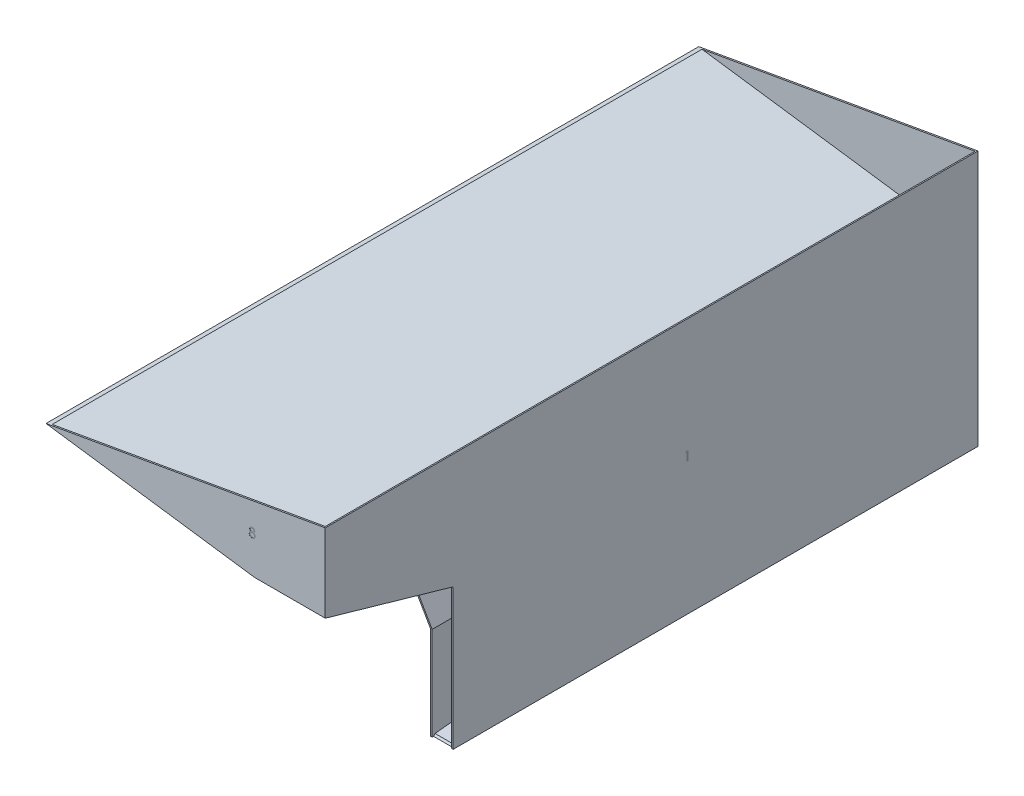
from build123d import *

# Parameters (mm, degrees)
BOSS_EXTRUDE1_DEPTH = 701.675
SHELL1_T            = -3.175
SKETCH3_W           = 42
SKETCH3_H           = 290
CUT_EXTRUDE1_DEPTH  = 20
SKETCH7_W           = 275
SKETCH7_H           = 302.7
CUT_EXTRUDE5_DEPTH  = 100
CUT_EXTRUDE7_DEPTH  = 988.549739455
BOSS_EXTRUDE3_DEPTH = 6.35
BOSS_EXTRUDE4_DEPTH = 42
CHAMFER1_SIZE       = 7.134884114
CHAMFER1_SIZE_2     = 6.35
CUT_EXTRUDE8_DEPTH  = 0.1
CUT_EXTRUDE9_DEPTH  = 0.1
CUT_EXTRUDE10_DEPTH = 0.1
CUT_EXTRUDE11_DEPTH = 0.1
CUT_EXTRUDE12_DEPTH = 0.1
CUT_EXTRUDE13_DEPTH = 0.1
CUT_EXTRUDE14_DEPTH = 0.1
CUT_EXTRUDE15_DEPTH = 0.1


with BuildPart() as part:
    # Sketch2 → Boss-Extrude1 (new, symmetric)
    with BuildSketch(Plane.XY):
        Polygon((0, 0), (-105, 181.865334795), (-551.988806236, 244.144070894), (48.35, 350), (48.35, -200), (0, -200), align=None)
    extrude(amount=BOSS_EXTRUDE1_DEPTH, both=True)

    # Shell1
    shell1_openings = [part.faces().sort_by_distance(p)[0] for p in [
        (-251.819403118, 297.072035447, 0),
    ]]
    offset(amount=SHELL1_T, openings=shell1_openings, kind=Kind.INTERSECTION)

    # Sketch3 → Cut-Extrude1 (cut)
    with BuildSketch(Plane.XY.offset(701.675)):
        with Locations((24.175, -42.3)):
            Rectangle(SKETCH3_W, SKETCH3_H)
    extrude(amount=-CUT_EXTRUDE1_DEPTH, mode=Mode.SUBTRACT)

    # Sketch7 → Cut-Extrude5 (cut, symmetric)
    with BuildSketch(Plane.ZY):
        with Locations((564.175, -48.65)):
            Rectangle(SKETCH7_W, SKETCH7_H)
    extrude(amount=CUT_EXTRUDE5_DEPTH, both=True, mode=Mode.SUBTRACT)

    # Sketch9 → Cut-Extrude7 (cut, through all)
    with BuildSketch(Plane(origin=(48.35, 0, 0), x_dir=(0, 0, -1), z_dir=(1, 0, 0))):
        Polygon((-701.675, 102.7), (-426.675, 102.7), (-701.675, 181.7), align=None)
    extrude(amount=-CUT_EXTRUDE7_DEPTH, mode=Mode.SUBTRACT)

    # Sketch11 → Boss-Extrude3 (add)
    with BuildSketch(Plane(origin=(0, -18.35715529, 5.273510065), x_dir=(1, 0, 0), z_dir=(0, -0.9611272890955623, 0.27610565759472516))):
        Polygon((48.35, 724.567388561), (48.35, 438.44503711), (-59.293872646, 438.44503711), (-104.904543912, 724.567388561), align=None)
    extrude(amount=-BOSS_EXTRUDE3_DEPTH)

    # Sketch12 → Boss-Extrude4 (add)
    with BuildSketch(Plane(origin=(3.175, 0, 0), x_dir=(0, 0, -1), z_dir=(1, 0, 0))):
        Polygon((688.975, -79.565459926), (-396.466892858, -193.65), (-396.466892858, -196.825), (688.975, -82.740459926), align=None)
        Polygon((-396.466892858, -193.65), (-426.675, -196.825), (-396.466892858, -196.825), align=None)
    extrude(amount=BOSS_EXTRUDE4_DEPTH)

    # Chamfer1
    # the kernel refuses this chamfer: 7.134884114, 6.35 mm, written as the material it takes off along each edge
    with BuildSketch(Plane(origin=(3.175, -196.825, 426.675), x_dir=(0, -0.9997021141585574, 0.02440661686737172), z_dir=(1, 0, 0))) as chamfer1_piece_1:
        Polygon((CHAMFER1_SIZE * 0.999702114118, CHAMFER1_SIZE * 0.0244066168664), (-CHAMFER1_SIZE_2 * 0.128770240585, CHAMFER1_SIZE_2 * 0.991674455222), (0, 0), align=None)
    extrude(amount=42, mode=Mode.SUBTRACT)

    # Sketch14 → Cut-Extrude8 (cut)
    with BuildSketch(Plane(origin=(48.35, 0, 0), x_dir=(0, 0, -1), z_dir=(1, 0, 0))):
        Polygon((74.636196394, 103.982801656), (78.158462019, 103.982801656), (78.158462019, 84.932801656), (76.448846634, 84.932801656), (76.448846634, 102.028955502), (73.518077403, 102.028955502), align=None)
    extrude(amount=-CUT_EXTRUDE8_DEPTH, mode=Mode.SUBTRACT)

    # Sketch15 → Cut-Extrude9 (cut)
    with BuildSketch(Plane(origin=(0, 0, -701.675), x_dir=(-1, 0, 0), z_dir=(0, 0, -1))):
        with BuildLine():
            Line((32.117058619, 218.448304315), (30.407443235, 218.448304315))
            add(Edge.make_bspline(
                [(30.407443235, 218.448304315), (30.418585596, 218.675113004), (30.440468897, 219.120559233), (30.542948586, 219.77002221), (30.689583932, 220.390806185), (30.896910275, 220.977926717), (31.154391586, 221.536575082), (31.463165021, 222.064532311), (31.82889155, 222.559784352), (32.243673917, 223.017740056), (32.694171795, 223.437860977), (33.180251266, 223.800655942), (33.691036343, 224.107184982), (34.224977357, 224.363441455), (34.788098425, 224.555791188), (35.375289408, 224.698511826), (35.989130136, 224.784380222), (36.407359399, 224.793610141), (36.620063427, 224.798304315)],
                knots=[0, 0, 0, 0, 1.10065271, 2.161652631, 3.183658789, 4.190468796, 5.17591951, 6.163126047, 7.15150782, 8.156236427, 9.156009102, 10.134482811, 11.092018607, 12.041330605, 13.001268258, 13.972401359, 14.968799086, 16, 16, 16, 16], degree=3))
            add(Edge.make_bspline(
                [(36.620063427, 224.798304315), (36.828949802, 224.793414145), (37.239404066, 224.783805135), (37.838455888, 224.701285819), (38.408743733, 224.572041956), (38.949152863, 224.390710904), (39.455371585, 224.146955664), (39.931202728, 223.854143346), (40.382311141, 223.515489692), (40.788385206, 223.116779651), (41.161264894, 222.691135244), (41.482950026, 222.236722511), (41.758430244, 221.767388828), (41.988051759, 221.27955533), (42.157085887, 220.768628733), (42.285418705, 220.242047529), (42.357957914, 219.694361058), (42.369090861, 219.323666805), (42.374750927, 219.135203353)],
                knots=[0, 0, 0, 0, 1.111607364, 2.184268762, 3.212621178, 4.221274766, 5.211760367, 6.196651075, 7.1921475, 8.207485113, 9.220403448, 10.201281604, 11.166441695, 12.114753415, 13.065576456, 14.026450734, 14.996634279, 16, 16, 16, 16], degree=3))
            add(Edge.make_bspline(
                [(42.374750927, 219.135203353), (42.365534739, 218.869875854), (42.347264095, 218.343876976), (42.190975845, 217.570910366), (41.946882692, 216.822009042), (41.652982792, 216.219281727), (41.356497061, 215.733596568), (41.08932077, 215.333716903), (40.776548013, 214.903157139), (40.413626474, 214.44335906), (40.008063555, 213.950721133), (39.55618578, 213.425540961), (39.054770828, 212.873244614), (38.702843846, 212.496024127), (38.5204841, 212.300557921)],
                knots=[0, 0, 0, 0, 1.184426356, 2.348067706, 3.509069118, 4.696110526, 5.333549288, 6.050745305, 6.844228056, 7.710549037, 8.667450064, 9.695053472, 10.805634456, 12, 12, 12, 12], degree=3))
            Line((38.5204841, 212.300557921), (33.754167994, 207.21368893))
            Line((33.754167994, 207.21368893), (42.618981696, 207.21368893))
            Line((42.618981696, 207.21368893), (42.618981696, 205.259842776))
            Line((42.618981696, 205.259842776), (29.674750927, 205.259842776))
            Line((29.674750927, 205.259842776), (37.062731696, 213.143917296))
            add(Edge.make_bspline(
                [(37.062731696, 213.143917296), (37.242606623, 213.33168665), (37.588109545, 213.692353151), (38.076783284, 214.218911263), (38.515689778, 214.707405192), (38.907670159, 215.156911977), (39.244221095, 215.574006653), (39.542882815, 215.945180683), (39.782181246, 216.286744191), (40.041889328, 216.682660961), (40.293425427, 217.166053716), (40.509574107, 217.756787081), (40.641372068, 218.364902557), (40.657182673, 218.775849358), (40.665135542, 218.982559123)],
                knots=[0, 0, 0, 0, 1.329631726, 2.553950428, 3.673215718, 4.687767853, 5.603093632, 6.413772471, 7.123043292, 7.734684054, 8.834405432, 9.900288307, 10.943827018, 12, 12, 12, 12], degree=3))
            add(Edge.make_bspline(
                [(40.665135542, 218.982559123), (40.661675288, 219.112542162), (40.654855791, 219.368713774), (40.594670323, 219.744302262), (40.503717426, 220.106605034), (40.373386807, 220.456736518), (40.201355836, 220.791176425), (39.991950725, 221.110331853), (39.750341951, 221.418881792), (39.470844328, 221.7081876), (39.163804485, 221.973152447), (38.839441498, 222.207870683), (38.496268787, 222.404026415), (38.135733265, 222.564827449), (37.758840067, 222.690967739), (37.36486024, 222.778372292), (36.95488238, 222.833249812), (36.674937211, 222.840674805), (36.532292994, 222.844458161)],
                knots=[0, 0, 0, 0, 0.991446411, 1.95395049, 2.89581595, 3.838931463, 4.798493298, 5.75982156, 6.748411868, 7.785213223, 8.824556874, 9.840280684, 10.836137867, 11.835679398, 12.848801643, 13.863922112, 14.911575587, 16, 16, 16, 16], degree=3))
            add(Edge.make_bspline(
                [(36.532292994, 222.844458161), (36.383317462, 222.840566343), (36.090754114, 222.832923454), (35.661209092, 222.779460097), (35.25143936, 222.687226308), (34.860414145, 222.561078981), (34.487471828, 222.400740308), (34.134426103, 222.201032383), (33.80206952, 221.962725085), (33.4897773, 221.692538628), (33.202046214, 221.39172497), (32.949242504, 221.056390743), (32.728349512, 220.692658667), (32.535622113, 220.301510185), (32.379109, 219.87939604), (32.259512281, 219.427814675), (32.164878158, 218.94872687), (32.13326321, 218.617882337), (32.117058619, 218.448304315)],
                knots=[0, 0, 0, 0, 1.031018746, 2.02475058, 2.990194455, 3.934040569, 4.864654155, 5.795059489, 6.735614925, 7.690564532, 8.649604399, 9.611025574, 10.590972636, 11.591080095, 12.624614302, 13.701020113, 14.821632451, 16, 16, 16, 16], degree=3))
        make_face()
    extrude(amount=-CUT_EXTRUDE9_DEPTH, mode=Mode.SUBTRACT)

    # Sketch16 → Cut-Extrude10 (cut)
    with BuildSketch(Plane(origin=(22.857155358, 164.05105863, 0), x_dir=(0.9904327144038478, -0.13799651531334484, 0), z_dir=(-0.13799651531334484, -0.9904327144038478, 0))):
        with BuildLine():
            Line((-366.527847763, -7.379708611), (-368.237463148, -7.379708611))
            add(Edge.make_bspline(
                [(-368.237463148, -7.379708611), (-368.191146879, -7.187943234), (-368.100602362, -6.813057607), (-367.911748427, -6.277440944), (-367.70601248, -5.77058292), (-367.458966068, -5.301974291), (-367.189496992, -4.862197406), (-366.880763322, -4.461226885), (-366.547008832, -4.088864888), (-366.177847322, -3.758411409), (-365.790704178, -3.459175483), (-365.380124319, -3.204041242), (-364.954368284, -2.984562639), (-364.510486231, -2.803749662), (-364.04715664, -2.667539312), (-363.568568261, -2.568714413), (-363.073466925, -2.504537063), (-362.73738361, -2.498273624), (-362.566729975, -2.495093226)],
                knots=[0, 0, 0, 0, 1.162005537, 2.271625781, 3.343758855, 4.383309926, 5.390229558, 6.379919256, 7.361854164, 8.333198761, 9.295911338, 10.242430842, 11.177959212, 12.116337295, 13.062827104, 14.020064771, 14.994644689, 16, 16, 16, 16], degree=3))
            add(Edge.make_bspline(
                [(-362.566729975, -2.495093226), (-362.318085336, -2.502600179), (-361.826219719, -2.517450337), (-361.103609421, -2.653056056), (-360.406777734, -2.867641419), (-359.743351971, -3.164134134), (-359.127120216, -3.529825081), (-358.578827543, -3.965061721), (-358.105905791, -4.46144649), (-357.709152107, -5.009719447), (-357.39850104, -5.595673006), (-357.169430922, -6.198742432), (-357.029975773, -6.817497162), (-357.011902456, -7.235276068), (-357.002847763, -7.444582409)],
                knots=[0, 0, 0, 0, 1.083050992, 2.142477498, 3.193116406, 4.255571735, 5.30263384, 6.308962982, 7.297363603, 8.282367274, 9.249857812, 10.179914175, 11.08814088, 12, 12, 12, 12], degree=3))
            add(Edge.make_bspline(
                [(-357.002847763, -7.444582409), (-357.009181023, -7.646005106), (-357.02157423, -8.040158066), (-357.126804827, -8.615585072), (-357.303895058, -9.157920068), (-357.549203337, -9.669446108), (-357.866748061, -10.146919879), (-358.251409454, -10.591415656), (-358.705902513, -11.004904931), (-359.050320733, -11.241775205), (-359.227637427, -11.363723034)],
                knots=[0, 0, 0, 0, 1.024540389, 2.004866551, 2.965041327, 3.920577974, 4.882998113, 5.874504559, 6.905732034, 8, 8, 8, 8], degree=3))
            add(Edge.make_bspline(
                [(-359.227637427, -11.363723034), (-359.024990305, -11.461575653), (-358.623487747, -11.655449994), (-358.076205579, -12.035664903), (-357.579393143, -12.474665879), (-357.302331473, -12.817253747), (-357.163124206, -12.989384091)],
                knots=[0, 0, 0, 0, 1.015518401, 2.012035669, 3.001164323, 4, 4, 4, 4], degree=3))
            add(Edge.make_bspline(
                [(-357.163124206, -12.989384091), (-357.071459185, -13.114884139), (-356.889630222, -13.363829085), (-356.665191103, -13.764077346), (-356.461578638, -14.168761881), (-356.302918158, -14.588729505), (-356.180051826, -15.019112622), (-356.092225708, -15.460650235), (-356.037665741, -15.9137029), (-356.029852236, -16.220203685), (-356.025924686, -16.374269909)],
                knots=[0, 0, 0, 0, 1.025084078, 2.033381695, 3.024893161, 4.013698104, 4.991890475, 5.976764909, 6.982997093, 8, 8, 8, 8], degree=3))
            add(Edge.make_bspline(
                [(-356.025924686, -16.374269909), (-356.035691967, -16.64102282), (-356.055180563, -17.173273298), (-356.229374168, -17.959628569), (-356.499411949, -18.728298803), (-356.882898987, -19.463491856), (-357.35026357, -20.151362216), (-357.906291292, -20.766820412), (-358.544664458, -21.29585853), (-359.256620918, -21.7378742), (-360.027967003, -22.091213176), (-360.852971297, -22.336454401), (-361.71974659, -22.496180485), (-362.31414631, -22.513308443), (-362.61633935, -22.522016303)],
                knots=[0, 0, 0, 0, 0.955779014, 1.907060117, 2.875433937, 3.871313158, 4.872415639, 5.851225146, 6.836215519, 7.83643374, 8.849228613, 9.86973379, 10.916971861, 12, 12, 12, 12], degree=3))
            add(Edge.make_bspline(
                [(-362.61633935, -22.522016303), (-362.820007256, -22.517290742), (-363.220757779, -22.507992415), (-363.809911677, -22.444427457), (-364.372276927, -22.328331285), (-364.908613881, -22.172103295), (-365.419399007, -21.974028241), (-365.903073637, -21.727365042), (-366.362613486, -21.437198152), (-366.793682063, -21.100102481), (-367.196227981, -20.723014047), (-367.559553523, -20.299238578), (-367.889716111, -19.836609851), (-368.17787533, -19.329754359), (-368.437156458, -18.785222316), (-368.650412807, -18.196041204), (-368.838112831, -17.56747817), (-368.925380686, -17.129449327), (-368.970155456, -16.904708611)],
                knots=[0, 0, 0, 0, 1.048658725, 2.063410685, 3.046034179, 4.001477787, 4.936774919, 5.862367409, 6.792675028, 7.730719943, 8.675894397, 9.627829632, 10.600096036, 11.597688215, 12.626045268, 13.701542398, 14.82072376, 16, 16, 16, 16], degree=3))
            Line((-368.970155456, -16.904708611), (-367.260540071, -16.904708611))
            add(Edge.make_bspline(
                [(-367.260540071, -16.904708611), (-367.215999585, -17.05138824), (-367.12936447, -17.33669286), (-366.981894076, -17.747303666), (-366.813882481, -18.12372107), (-366.633644669, -18.468706349), (-366.444350556, -18.785656996), (-366.232542178, -19.066192026), (-366.013907259, -19.322633341), (-365.849101064, -19.467111872), (-365.768442715, -19.537821591)],
                knots=[0, 0, 0, 0, 1.198163088, 2.33053128, 3.407730985, 4.417276592, 5.372219308, 6.28897303, 7.162600585, 8, 8, 8, 8], degree=3))
            add(Edge.make_bspline(
                [(-365.768442715, -19.537821591), (-365.661781349, -19.620054094), (-365.448787855, -19.784265267), (-365.101706483, -19.993824131), (-364.736681889, -20.175403426), (-364.345804876, -20.314107542), (-363.937510197, -20.431551667), (-363.505198395, -20.508407635), (-363.052683513, -20.561138968), (-362.743704686, -20.565792238), (-362.585810504, -20.568170149)],
                knots=[0, 0, 0, 0, 0.946170439, 1.889420265, 2.845303464, 3.807233317, 4.801018734, 5.828864929, 6.890507805, 8, 8, 8, 8], degree=3))
            add(Edge.make_bspline(
                [(-362.585810504, -20.568170149), (-362.407537868, -20.564817865), (-362.058941118, -20.558262762), (-361.550279669, -20.497979272), (-361.066369133, -20.410183736), (-360.612582209, -20.27458593), (-360.182974733, -20.107050152), (-359.783568897, -19.896692403), (-359.409121519, -19.649887561), (-359.064428613, -19.369367283), (-358.75448235, -19.062273146), (-358.481580143, -18.74107343), (-358.249580199, -18.407122415), (-358.062435295, -18.058572071), (-357.914658729, -17.696865754), (-357.814057308, -17.320988411), (-357.744108347, -16.934016148), (-357.738411787, -16.670968474), (-357.735540071, -16.538362457)],
                knots=[0, 0, 0, 0, 1.217147791, 2.380027433, 3.494444702, 4.572153297, 5.609568379, 6.639424714, 7.649109417, 8.668170816, 9.669597737, 10.625200337, 11.543417969, 12.441394052, 13.322311151, 14.205496177, 15.095365482, 16, 16, 16, 16], degree=3))
            add(Edge.make_bspline(
                [(-357.735540071, -16.538362457), (-357.743869283, -16.360863598), (-357.760486264, -16.00674909), (-357.887351532, -15.485772007), (-358.096024493, -14.983813148), (-358.388156304, -14.509436634), (-358.743769342, -14.069784941), (-359.15941262, -13.677510158), (-359.638537692, -13.353822948), (-360.079517265, -13.130183261), (-360.47012476, -12.977581466), (-360.804399923, -12.875936303), (-361.178632293, -12.789864834), (-361.588296278, -12.709788042), (-362.036478642, -12.641636132), (-362.522691454, -12.584802821), (-363.047033242, -12.539327527), (-363.410023731, -12.519019708), (-363.597078532, -12.508554765)],
                knots=[0, 0, 0, 0, 1.07054697, 2.135767047, 3.216561865, 4.33974944, 5.486079747, 6.621378074, 7.775625952, 8.963672916, 9.598146892, 10.304877434, 11.070270905, 11.915000392, 12.823868403, 13.805723172, 14.86925407, 16, 16, 16, 16], degree=3))
            Line((-363.597078532, -12.508554765), (-363.597078532, -10.554708611))
            add(Edge.make_bspline(
                [(-363.597078532, -10.554708611), (-363.361396473, -10.550709179), (-362.899753216, -10.542875275), (-362.225414214, -10.448125961), (-361.580580901, -10.317058543), (-360.979543919, -10.11629771), (-360.431727351, -9.883124095), (-359.956459231, -9.61178564), (-359.560398044, -9.310171076), (-359.245468497, -8.973625017), (-359.008545124, -8.612681687), (-358.835316413, -8.236489593), (-358.732988923, -7.84175149), (-358.719329164, -7.572359083), (-358.712463148, -7.436950197)],
                knots=[0, 0, 0, 0, 1.321986639, 2.589447074, 3.816329219, 5.01088745, 6.139805852, 7.153945165, 8.075214402, 8.924034688, 9.728124013, 10.488707548, 11.240355623, 12, 12, 12, 12], degree=3))
            add(Edge.make_bspline(
                [(-358.712463148, -7.436950197), (-358.714718727, -7.337467041), (-358.719206096, -7.139550021), (-358.775796994, -6.850397862), (-358.860836417, -6.57008557), (-358.977747515, -6.299805203), (-359.134230739, -6.041431284), (-359.321497609, -5.792761026), (-359.544481126, -5.555214172), (-359.799998488, -5.333797004), (-360.074382741, -5.122781584), (-360.375099373, -4.94363736), (-360.693081291, -4.790447808), (-361.028680541, -4.664121804), (-361.382986213, -4.569093392), (-361.75433362, -4.500862598), (-362.143430869, -4.458203363), (-362.408888439, -4.452061557), (-362.54383334, -4.44893938)],
                knots=[0, 0, 0, 0, 0.884392785, 1.759457502, 2.611959086, 3.489218968, 4.37281399, 5.2945488, 6.255912374, 7.266815255, 8.301784654, 9.332968512, 10.37626691, 11.440494194, 12.520033166, 13.637162961, 14.798855837, 16, 16, 16, 16], degree=3))
            add(Edge.make_bspline(
                [(-362.54383334, -4.44893938), (-362.760740276, -4.456512365), (-363.18440997, -4.471304165), (-363.795179732, -4.600860567), (-364.362974965, -4.80756985), (-364.796981136, -5.054310998), (-365.117470575, -5.297881217), (-365.346489339, -5.510601063), (-365.571390974, -5.746999717), (-365.777379586, -6.021637445), (-365.985699374, -6.315915261), (-366.175353344, -6.644792727), (-366.359646812, -6.999690931), (-366.470694975, -7.250582884), (-366.527847763, -7.379708611)],
                knots=[0, 0, 0, 0, 1.472543308, 2.876219568, 4.221790263, 5.565193594, 6.249813518, 6.953379497, 7.687249741, 8.463570142, 9.283606569, 10.136032583, 11.040678096, 12, 12, 12, 12], degree=3))
        make_face()
    extrude(amount=-CUT_EXTRUDE10_DEPTH, mode=Mode.SUBTRACT)

    # Sketch17 → Cut-Extrude11 (cut)
    with BuildSketch(Plane(origin=(0, 0, 0), x_dir=(0, 0, 1), z_dir=(-0.8660254037844379, -0.5000000000000014, 0))):
        Polygon((-17.833703536, 134.05795176), (-17.486437911, 134.05795176), (-17.486437911, 120.869490222), (-15.288360988, 120.869490222), (-15.288360988, 118.915644068), (-17.486437911, 118.915644068), (-17.486437911, 114.519490222), (-19.196053296, 114.519490222), (-19.196053296, 118.915644068), (-28.232591757, 118.915644068), align=None)
        Polygon((-19.196053296, 120.869490222), (-19.196053296, 129.142807529), (-24.874418681, 120.869490222), align=None, mode=Mode.SUBTRACT)
    extrude(amount=-CUT_EXTRUDE11_DEPTH, mode=Mode.SUBTRACT)

    # Sketch18 → Cut-Extrude12 (cut)
    with BuildSketch(Plane.ZY):
        with BuildLine():
            Line((-168.934113703, -82.768057658), (-168.934113703, -84.721903812))
            Line((-168.934113703, -84.721903812), (-175.413861299, -84.721903812))
            Line((-175.413861299, -84.721903812), (-176.440393751, -89.732450687))
            add(Edge.make_bspline(
                [(-176.440393751, -89.732450687), (-176.238703921, -89.676768779), (-175.847961773, -89.568893889), (-175.271237387, -89.449119624), (-174.723728394, -89.376917707), (-174.368443878, -89.367059003), (-174.196523559, -89.362288427)],
                knots=[0, 0, 0, 0, 1.100273476, 2.13160584, 3.095893838, 4, 4, 4, 4], degree=3))
            add(Edge.make_bspline(
                [(-174.196523559, -89.362288427), (-173.983796347, -89.366892734), (-173.565521499, -89.375945953), (-172.953532373, -89.462878447), (-172.369334768, -89.599711411), (-171.814150439, -89.790867394), (-171.286952299, -90.035304656), (-170.792590858, -90.340648617), (-170.323645646, -90.697337177), (-169.888529527, -91.107429313), (-169.493790078, -91.558759827), (-169.146720906, -92.044033383), (-168.851921665, -92.558533944), (-168.614826699, -93.107177257), (-168.425500536, -93.683897792), (-168.299487536, -94.294763705), (-168.215576591, -94.934017044), (-168.206201889, -95.371103347), (-168.201421395, -95.593989148)],
                knots=[0, 0, 0, 0, 1.052922333, 2.070308379, 3.05430497, 4.020497103, 4.973039431, 5.925935799, 6.892292201, 7.88610001, 8.88166317, 9.857072816, 10.836096531, 11.812156883, 12.81219415, 13.836441305, 14.89672472, 16, 16, 16, 16], degree=3))
            add(Edge.make_bspline(
                [(-168.201421395, -95.593989148), (-168.205041305, -95.749231519), (-168.212232205, -96.057618294), (-168.248800517, -96.515603158), (-168.319207772, -96.963892292), (-168.413737813, -97.402545168), (-168.536432974, -97.830731322), (-168.684963396, -98.249676353), (-168.866733203, -98.656772712), (-169.066112545, -99.055872363), (-169.290611233, -99.437952809), (-169.539777108, -99.795270864), (-169.803023568, -100.133186739), (-170.086277394, -100.448076343), (-170.392171382, -100.737870483), (-170.717000916, -101.004288987), (-171.058174001, -101.25183737), (-171.420968963, -101.470467118), (-171.79730162, -101.671651208), (-172.19260663, -101.83669789), (-172.597885586, -101.984256622), (-173.018971552, -102.101874193), (-173.454910732, -102.194035669), (-173.906421724, -102.256631795), (-174.371136514, -102.302223547), (-174.686141939, -102.305077547), (-174.84526154, -102.306519196)],
                knots=[0, 0, 0, 0, 1.056347294, 2.098418968, 3.122841568, 4.141288669, 5.149314143, 6.15115421, 7.162517403, 8.180376062, 9.185164535, 10.17417709, 11.141909838, 12.097768115, 13.052685741, 14.0056014, 14.954263652, 15.917497458, 16.885230207, 17.854509472, 18.828990115, 19.81800267, 20.826176721, 21.857883937, 22.917946725, 24, 24, 24, 24], degree=3))
            add(Edge.make_bspline(
                [(-174.84526154, -102.306519196), (-175.035076723, -102.302759064), (-175.408515673, -102.295361448), (-175.95563476, -102.217972264), (-176.482038542, -102.107134376), (-176.983489521, -101.940385536), (-177.464481685, -101.731448975), (-177.918539621, -101.467382384), (-178.357265344, -101.168138976), (-178.762823716, -100.815004484), (-179.139230562, -100.429020557), (-179.476178846, -100.01015111), (-179.776263028, -99.565309433), (-180.034677622, -99.092335194), (-180.255102567, -98.59247119), (-180.428267003, -98.063844571), (-180.568030621, -97.509217407), (-180.627158667, -97.127381871), (-180.657190626, -96.933442273)],
                knots=[0, 0, 0, 0, 1.0467383, 2.05933395, 3.04377827, 4.011590433, 4.970194871, 5.932262533, 6.905835911, 7.896367577, 8.894135286, 9.877477877, 10.858688626, 11.851381753, 12.8477658, 13.868841284, 14.917554742, 16, 16, 16, 16], degree=3))
            Line((-180.657190626, -96.933442273), (-178.947575242, -96.933442273))
            add(Edge.make_bspline(
                [(-178.947575242, -96.933442273), (-178.905509808, -97.115105536), (-178.824657708, -97.464272414), (-178.647189276, -97.954844429), (-178.430205011, -98.392010489), (-178.172189914, -98.781553507), (-177.864396177, -99.121236763), (-177.513171714, -99.423952486), (-177.119393392, -99.697048547), (-176.681824528, -99.924683894), (-176.220199054, -100.118823823), (-175.737051811, -100.248100906), (-175.245538153, -100.33900148), (-174.91309731, -100.348100635), (-174.74604279, -100.352673043)],
                knots=[0, 0, 0, 0, 1.136247022, 2.183929868, 3.172523383, 4.106158343, 5.02341133, 5.958108904, 6.928429099, 7.938127109, 8.96079061, 9.975095812, 10.982467395, 12, 12, 12, 12], degree=3))
            add(Edge.make_bspline(
                [(-174.74604279, -100.352673043), (-174.582983257, -100.348205666), (-174.261917701, -100.339409364), (-173.789415725, -100.271705598), (-173.333234224, -100.167433674), (-172.897874468, -100.01138775), (-172.475718088, -99.821732925), (-172.077443709, -99.578355155), (-171.691529478, -99.298265626), (-171.329970637, -98.977373111), (-170.998830206, -98.623752345), (-170.706243318, -98.245596818), (-170.462528975, -97.84218941), (-170.257147611, -97.420514107), (-170.101191799, -96.975949388), (-169.989934458, -96.510578706), (-169.924603524, -96.0232526), (-169.915616387, -95.690861071), (-169.91103678, -95.521483139)],
                knots=[0, 0, 0, 0, 1.027316725, 2.022795036, 3.002884548, 3.971462791, 4.93288096, 5.914575861, 6.907176829, 7.935150275, 8.956128384, 9.956726525, 10.942570165, 11.921478529, 12.907843606, 13.90538589, 14.932640048, 16, 16, 16, 16], degree=3))
            add(Edge.make_bspline(
                [(-169.91103678, -95.521483139), (-169.91462079, -95.368670834), (-169.921635979, -95.069562489), (-169.978952368, -94.631961094), (-170.078649032, -94.217906392), (-170.217027579, -93.825398919), (-170.392720328, -93.454068468), (-170.607420971, -93.103531812), (-170.865158751, -92.778409091), (-171.159573173, -92.478548192), (-171.482106225, -92.201806802), (-171.838307167, -91.965891131), (-172.220721911, -91.767423237), (-172.624743017, -91.596147417), (-173.059980536, -91.473134788), (-173.517815349, -91.380781012), (-174.003191431, -91.327357395), (-174.335046177, -91.319944831), (-174.505628126, -91.316134581)],
                knots=[0, 0, 0, 0, 1.045622112, 2.046656509, 3.013763289, 3.955457236, 4.890082067, 5.820317437, 6.762574623, 7.722996705, 8.69280354, 9.665887285, 10.63943826, 11.638615906, 12.663482002, 13.728887084, 14.832589034, 16, 16, 16, 16], degree=3))
            add(Edge.make_bspline(
                [(-174.505628126, -91.316134581), (-174.65328701, -91.319294656), (-174.958165144, -91.325819408), (-175.425830815, -91.37386077), (-175.917275765, -91.451363215), (-176.430616091, -91.557968362), (-176.967393427, -91.697474651), (-177.526475009, -91.86464929), (-178.109036345, -92.064521883), (-178.501562817, -92.215464361), (-178.703344472, -92.293057658)],
                knots=[0, 0, 0, 0, 0.817624296, 1.688186739, 2.600797293, 3.572016777, 4.590301741, 5.671205678, 6.80286297, 8, 8, 8, 8], degree=3))
            Line((-178.703344472, -92.293057658), (-176.749498319, -82.768057658))
            Line((-176.749498319, -82.768057658), (-168.934113703, -82.768057658))
        make_face()
    extrude(amount=-CUT_EXTRUDE12_DEPTH, mode=Mode.SUBTRACT)

    # Sketch19 → Cut-Extrude13 (cut)
    with BuildSketch(Plane.XZ.offset(200)):
        with BuildLine():
            Line((27.016840932, -53.745297726), (28.333397422, -54.77946239))
            Line((28.333397422, -54.77946239), (23.299953912, -62.476547726))
            add(Edge.make_bspline(
                [(23.299953912, -62.476547726), (23.635072134, -62.423132285), (24.288758116, -62.318939426), (24.950423936, -62.30175118), (25.272880595, -62.293374649)],
                knots=[0, 0, 0, 0, 1.025318673, 2, 2, 2, 2], degree=3))
            add(Edge.make_bspline(
                [(25.272880595, -62.293374649), (25.466496611, -62.298578629), (25.847623976, -62.308822507), (26.407186714, -62.387656037), (26.944880779, -62.511889861), (27.458477555, -62.692985997), (27.949820499, -62.92432024), (28.421729255, -63.201573234), (28.865333053, -63.539061294), (29.286344471, -63.916060553), (29.66858053, -64.33362014), (30.006995918, -64.776675987), (30.291258884, -65.244766497), (30.521894086, -65.737654581), (30.70099064, -66.254580465), (30.831551965, -66.794882767), (30.908729463, -67.358934062), (30.919209634, -67.742536702), (30.924533239, -67.937395082)],
                knots=[0, 0, 0, 0, 1.04369286, 2.054478336, 3.041073146, 4.015093852, 4.984733326, 5.965804835, 6.960378782, 7.985147595, 9.009457201, 10.008161701, 10.986880575, 11.956520048, 12.937015923, 13.931873656, 14.949455224, 16, 16, 16, 16], degree=3))
            add(Edge.make_bspline(
                [(30.924533239, -67.937395082), (30.916787483, -68.203984613), (30.901545667, -68.728569721), (30.749669291, -69.49262008), (30.513668939, -70.220507057), (30.176334106, -70.900609319), (29.757329993, -71.531994733), (29.246367667, -72.091441338), (28.661568109, -72.590388255), (28.000332822, -73.007619283), (27.288717546, -73.348358746), (26.541130246, -73.593098135), (25.764831063, -73.743775304), (25.237937411, -73.762665299), (24.971408239, -73.772220803)],
                knots=[0, 0, 0, 0, 1.031375318, 2.029502543, 3.004789286, 3.987476834, 4.960371455, 5.9300674, 6.912260825, 7.929083631, 8.949397511, 9.960523116, 10.96833055, 12, 12, 12, 12], degree=3))
            add(Edge.make_bspline(
                [(24.971408239, -73.772220803), (24.715067626, -73.763902997), (24.207301752, -73.747426881), (23.460363258, -73.600655133), (22.742651692, -73.362763617), (22.05919549, -73.035025901), (21.426079011, -72.621053709), (20.859664618, -72.122693304), (20.362776531, -71.550597502), (19.949257523, -70.90485504), (19.621277853, -70.210945414), (19.375315547, -69.487387463), (19.231644566, -68.736817562), (19.211568278, -68.228013076), (19.201456316, -67.971740034)],
                knots=[0, 0, 0, 0, 1.012016664, 2.004627821, 2.994792927, 3.992885782, 4.990978636, 5.973936114, 6.964471063, 7.975201453, 8.993600317, 9.990122807, 10.98767138, 12, 12, 12, 12], degree=3))
            add(Edge.make_bspline(
                [(19.201456316, -67.971740034), (19.207886753, -67.775554517), (19.221016475, -67.374981175), (19.312692642, -66.768298394), (19.460002454, -66.147534649), (19.624976795, -65.620915396), (19.799287615, -65.189506255), (19.944353581, -64.841688684), (20.124914902, -64.483760557), (20.317447163, -64.103448339), (20.539280978, -63.710553341), (20.780484726, -63.298509083), (21.047727112, -62.873868648), (21.235071141, -62.585700956), (21.330843335, -62.438386668)],
                knots=[0, 0, 0, 0, 1.173818275, 2.396712641, 3.66331629, 4.989737886, 5.693666774, 6.447286557, 7.243889047, 8.091586357, 8.998013824, 9.943181721, 10.948533338, 12, 12, 12, 12], degree=3))
            Line((21.330843335, -62.438386668), (27.016840932, -53.745297726))
        make_face()
        with BuildLine():
            add(Edge.make_bspline(
                [(24.914166653, -64.247220803), (24.769047863, -64.251455584), (24.48558871, -64.25972734), (24.069714067, -64.307761926), (23.67612337, -64.398217126), (23.299602114, -64.513422447), (22.947189617, -64.671826243), (22.616324646, -64.864241035), (22.30572772, -65.090779161), (22.018652103, -65.348231263), (21.758376507, -65.630106129), (21.534233495, -65.932018814), (21.340890146, -66.246693262), (21.183690532, -66.57675869), (21.061280262, -66.922088924), (20.972734497, -67.281095695), (20.923456222, -67.656186419), (20.91525802, -67.910544755), (20.911071701, -68.040429938)],
                knots=[0, 0, 0, 0, 1.129588631, 2.206414736, 3.251139165, 4.268635594, 5.265702196, 6.250456724, 7.242448911, 8.251968645, 9.246821453, 10.222880186, 11.173611482, 12.116736599, 13.062300278, 14.020270554, 14.989073742, 16, 16, 16, 16], degree=3))
            add(Edge.make_bspline(
                [(20.911071701, -68.040429938), (20.914480897, -68.1691534), (20.921165823, -68.421560945), (20.981866307, -68.793521337), (21.074585826, -69.151470338), (21.212509981, -69.493562612), (21.377030615, -69.825012571), (21.594229594, -70.133814625), (21.834895242, -70.438723864), (22.122571651, -70.716317587), (22.431308813, -70.974617213), (22.761152501, -71.200388307), (23.104923139, -71.393534479), (23.46726188, -71.54490631), (23.843027941, -71.669135643), (24.235352099, -71.75655598), (24.644507213, -71.805979986), (24.921668047, -71.814188868), (25.062994778, -71.818374649)],
                knots=[0, 0, 0, 0, 0.989467248, 1.94019797, 2.891935182, 3.827694429, 4.772920941, 5.730924762, 6.725747692, 7.756678648, 8.79901574, 9.819492441, 10.826891316, 11.826466727, 12.835195252, 13.867842842, 14.912794438, 16, 16, 16, 16], degree=3))
            add(Edge.make_bspline(
                [(25.062994778, -71.818374649), (25.204321277, -71.81418854), (25.481481657, -71.805979014), (25.890640062, -71.756559674), (26.282952053, -71.66912209), (26.658762336, -71.54495544), (27.020937839, -71.393352223), (27.364407823, -71.201589917), (27.691132161, -70.973228761), (28.000071996, -70.716759002), (28.286551003, -70.437143908), (28.532988764, -70.136536419), (28.743536076, -69.822516788), (28.914627866, -69.494868273), (29.051032894, -69.151263491), (29.144222594, -68.79357675), (29.204797724, -68.421546438), (29.211499874, -68.1691485), (29.214917855, -68.040429938)],
                knots=[0, 0, 0, 0, 1.087397944, 2.132534446, 3.165364764, 4.174271784, 5.174024072, 6.181601208, 7.194203697, 8.236725232, 9.267838612, 10.269026844, 11.221737037, 12.171628256, 13.107553087, 14.05945871, 15.010357665, 16, 16, 16, 16], degree=3))
            add(Edge.make_bspline(
                [(29.214917855, -68.040429938), (29.211922688, -67.91037531), (29.206044151, -67.655120373), (29.139554488, -67.28126348), (29.047339568, -66.920264857), (28.908094786, -66.574393335), (28.727193021, -66.245013788), (28.50684762, -65.93046236), (28.25194463, -65.62832747), (27.957499451, -65.34767847), (27.63696832, -65.09106366), (27.296160634, -64.86453436), (26.939610091, -64.67335413), (26.567678205, -64.513839759), (26.176103372, -64.398726193), (25.771207383, -64.30808497), (25.347811648, -64.259850273), (25.060556109, -64.251484247), (24.914166653, -64.247220803)],
                knots=[0, 0, 0, 0, 0.978206639, 1.919901502, 2.851605144, 3.780102724, 4.718870031, 5.675451981, 6.667674623, 7.690630536, 8.733308323, 9.756129687, 10.767539656, 11.776269907, 12.797430371, 13.836405707, 14.897401972, 16, 16, 16, 16], degree=3))
        make_face(mode=Mode.SUBTRACT)
    extrude(amount=-CUT_EXTRUDE13_DEPTH, mode=Mode.SUBTRACT)

    # Sketch20 → Cut-Extrude14 (cut)
    with BuildSketch(Plane(origin=(0, -18.35715529, 5.273510065), x_dir=(1, 0, 0), z_dir=(0, -0.9611272890955623, 0.2761056575947251))):
        Polygon((-12.66292019, 609.435389752), (-0.939843267, 609.435389752), (-10.953304805, 589.896928213), (-12.430137738, 590.709758742), (-3.83245144, 607.481543598), (-12.66292019, 607.481543598), align=None)
    extrude(amount=-CUT_EXTRUDE14_DEPTH, mode=Mode.SUBTRACT)

    # Sketch21 → Cut-Extrude15 (cut)
    with BuildSketch(Plane.XY.offset(701.675)):
        with BuildLine():
            add(Edge.make_bspline(
                [(-105.782232215, 263.577393181), (-105.626302266, 263.496088021), (-105.322186789, 263.337515805), (-104.889059413, 263.082186872), (-104.49322762, 262.813086763), (-104.123708991, 262.542925871), (-103.78699561, 262.261357882), (-103.486852449, 261.967263132), (-103.215865546, 261.667982487), (-102.979499765, 261.358448071), (-102.771599839, 261.039482224), (-102.591919503, 260.710247752), (-102.438337299, 260.371466179), (-102.316619019, 260.019439433), (-102.216351838, 259.65933858), (-102.147360331, 259.28651385), (-102.110256821, 258.903421938), (-102.103241993, 258.644514467), (-102.099690148, 258.513420825)],
                knots=[0, 0, 0, 0, 1.272397273, 2.481599622, 3.635517121, 4.734568067, 5.792894095, 6.808321871, 7.773003508, 8.711915296, 9.623354172, 10.525449501, 11.423591555, 12.311487226, 13.218079475, 14.126165749, 15.051214107, 16, 16, 16, 16], degree=3))
            add(Edge.make_bspline(
                [(-102.099690148, 258.513420825), (-102.10388888, 258.330008881), (-102.112199745, 257.966967823), (-102.184589659, 257.431139702), (-102.292973156, 256.910738432), (-102.451248787, 256.405878103), (-102.656517386, 255.919344514), (-102.909484164, 255.45072119), (-103.195839438, 254.992327521), (-103.42581234, 254.710281921), (-103.542178129, 254.56756746)],
                knots=[0, 0, 0, 0, 1.025265484, 2.029385089, 3.018602448, 3.995076438, 4.983346944, 5.966715145, 6.97116228, 8, 8, 8, 8], degree=3))
            add(Edge.make_bspline(
                [(-103.542178129, 254.56756746), (-103.693688082, 254.401049918), (-103.994835737, 254.070072536), (-104.510725672, 253.640354556), (-105.076901925, 253.279224283), (-105.691173707, 252.984918685), (-106.351899016, 252.755851367), (-107.05893707, 252.591245663), (-107.813666245, 252.496962155), (-108.332400309, 252.483333297), (-108.598518273, 252.476341498)],
                knots=[0, 0, 0, 0, 0.954267603, 1.896743057, 2.838368354, 3.796610408, 4.779680527, 5.799409237, 6.871065594, 8, 8, 8, 8], degree=3))
            add(Edge.make_bspline(
                [(-108.598518273, 252.476341498), (-108.854405431, 252.482614271), (-109.35233585, 252.49482045), (-110.077095154, 252.577521571), (-110.752679292, 252.722453245), (-111.383016405, 252.920816047), (-111.964306436, 253.178863147), (-112.494893029, 253.500037486), (-112.982431364, 253.871411478), (-113.412125742, 254.303650961), (-113.793607129, 254.766608809), (-114.128713246, 255.244228285), (-114.407246445, 255.736552988), (-114.643069636, 256.23624193), (-114.823598445, 256.750298854), (-114.948632904, 257.276078926), (-115.028040456, 257.812663775), (-115.038605776, 258.174786059), (-115.043920917, 258.356960489)],
                knots=[0, 0, 0, 0, 1.256902934, 2.445805442, 3.576955095, 4.645999104, 5.686449165, 6.692658513, 7.68621702, 8.689161843, 9.678783111, 10.630372946, 11.551080876, 12.453998257, 13.34127905, 14.221779781, 15.105423033, 16, 16, 16, 16], degree=3))
            add(Edge.make_bspline(
                [(-115.043920917, 258.356960489), (-115.040775593, 258.490632663), (-115.034559323, 258.754816059), (-114.991534364, 259.145119689), (-114.922364024, 259.525010079), (-114.828423266, 259.895890413), (-114.701109251, 260.255060596), (-114.547391355, 260.60422246), (-114.368147442, 260.943770199), (-114.160877101, 261.27556068), (-113.919747513, 261.594944882), (-113.646713934, 261.907343081), (-113.336319391, 262.207907815), (-112.992016991, 262.5003113), (-112.617741426, 262.789740528), (-112.203771153, 263.060553851), (-111.761080352, 263.331923631), (-111.446453788, 263.494166088), (-111.285056735, 263.577393181)],
                knots=[0, 0, 0, 0, 0.941657376, 1.861047343, 2.762797495, 3.66048619, 4.553285746, 5.444104102, 6.34607688, 7.256116206, 8.197091036, 9.162375105, 10.176350973, 11.237807142, 12.343728897, 13.50695164, 14.721116704, 16, 16, 16, 16], degree=3))
            add(Edge.make_bspline(
                [(-111.285056735, 263.577393181), (-111.505989788, 263.697869565), (-111.933778019, 263.931145564), (-112.50021312, 264.35975318), (-112.986753513, 264.823962572), (-113.380025619, 265.33357617), (-113.689573032, 265.872674157), (-113.901945722, 266.437883588), (-114.045618014, 267.018724149), (-114.059850145, 267.415542162), (-114.06699784, 267.614833085)],
                knots=[0, 0, 0, 0, 1.166880483, 2.259407225, 3.286803203, 4.280235371, 5.237608625, 6.161067461, 7.076446754, 8, 8, 8, 8], degree=3))
            add(Edge.make_bspline(
                [(-114.06699784, 267.614833085), (-114.058096461, 267.817838367), (-114.040203135, 268.225914387), (-113.895513919, 268.833370573), (-113.659728985, 269.429997877), (-113.339030416, 270.012904542), (-112.939594282, 270.562362139), (-112.460369511, 271.055163575), (-111.912800139, 271.486844644), (-111.299619462, 271.849209242), (-110.639747951, 272.144123156), (-109.943520939, 272.347568572), (-109.223069027, 272.480570864), (-108.732680011, 272.49562937), (-108.4840351, 272.503264575)],
                knots=[0, 0, 0, 0, 0.888701115, 1.786444228, 2.72001202, 3.692817113, 4.693886446, 5.687152267, 6.695133018, 7.739871481, 8.800368666, 9.853104506, 10.91144658, 12, 12, 12, 12], degree=3))
            add(Edge.make_bspline(
                [(-108.4840351, 272.503264575), (-108.241807193, 272.495392336), (-107.764161355, 272.479869178), (-107.062062025, 272.350400599), (-106.390278049, 272.134158499), (-105.751126062, 271.840803612), (-105.156048326, 271.479468977), (-104.630255757, 271.041858505), (-104.165802704, 270.551230922), (-103.781621929, 270.001939938), (-103.465049631, 269.421273113), (-103.244609012, 268.813727678), (-103.103356125, 268.192430657), (-103.085539672, 267.772035236), (-103.076613225, 267.561407604)],
                knots=[0, 0, 0, 0, 1.072916533, 2.115669174, 3.151510826, 4.193348718, 5.225979165, 6.227137561, 7.216255879, 8.211077061, 9.189680878, 10.138522389, 11.067357538, 12, 12, 12, 12], degree=3))
            add(Edge.make_bspline(
                [(-103.076613225, 267.561407604), (-103.084421334, 267.354706048), (-103.099756015, 266.94875594), (-103.2287514, 266.356973022), (-103.445993864, 265.80277021), (-103.742597808, 265.279858856), (-104.12917939, 264.797722419), (-104.600578352, 264.350229918), (-105.153036398, 263.933705324), (-105.568113507, 263.698648113), (-105.782232215, 263.577393181)],
                knots=[0, 0, 0, 0, 0.975232327, 1.915300861, 2.843280834, 3.77672583, 4.742871857, 5.749627742, 6.839139064, 8, 8, 8, 8], degree=3))
        make_face()
        with BuildLine():
            add(Edge.make_bspline(
                [(-108.579437744, 270.549418422), (-108.713064273, 270.545872724), (-108.974496193, 270.538935788), (-109.357829388, 270.502693778), (-109.722350416, 270.43219127), (-110.071867845, 270.338363425), (-110.401589666, 270.211610233), (-110.715993885, 270.062503111), (-111.009729589, 269.881222955), (-111.286342681, 269.677871292), (-111.535357611, 269.454208474), (-111.756362385, 269.221179519), (-111.939939692, 268.974207743), (-112.095829159, 268.719436527), (-112.20893999, 268.449304391), (-112.293654273, 268.172093274), (-112.350920704, 267.884300112), (-112.355211798, 267.687614247), (-112.357382456, 267.588120345)],
                knots=[0, 0, 0, 0, 1.203892937, 2.355340988, 3.463153438, 4.544400666, 5.610487187, 6.640501085, 7.674077295, 8.714426146, 9.728707835, 10.68524104, 11.601827946, 12.495867327, 13.368432065, 14.231010473, 15.105153427, 16, 16, 16, 16], degree=3))
            add(Edge.make_bspline(
                [(-112.357382456, 267.588120345), (-112.353641216, 267.488622143), (-112.346247988, 267.291999402), (-112.289070077, 267.001645475), (-112.203852053, 266.716321995), (-112.069682025, 266.442813464), (-111.90875656, 266.171632038), (-111.710138669, 265.909555277), (-111.473434103, 265.655671111), (-111.206584749, 265.412138952), (-110.915873379, 265.18408997), (-110.607894515, 264.986115939), (-110.286513442, 264.820467424), (-109.95503218, 264.682603092), (-109.610072345, 264.575433576), (-109.253747682, 264.499404229), (-108.885998305, 264.452149361), (-108.636821144, 264.446505002), (-108.51074784, 264.443649191)],
                knots=[0, 0, 0, 0, 0.873023192, 1.725219244, 2.590779336, 3.480155217, 4.391973325, 5.357036234, 6.360879153, 7.436073238, 8.526419356, 9.601555421, 10.645666583, 11.697338044, 12.750135903, 13.812665442, 14.89329948, 16, 16, 16, 16], degree=3))
            add(Edge.make_bspline(
                [(-108.51074784, 264.443649191), (-108.348822275, 264.448400082), (-108.026570474, 264.45785494), (-107.551521541, 264.545763472), (-107.089626291, 264.684044252), (-106.645821682, 264.873237783), (-106.231595297, 265.110697992), (-105.862351497, 265.394994847), (-105.541239837, 265.719563833), (-105.271597373, 266.079352125), (-105.062538066, 266.46226577), (-104.899786798, 266.846533078), (-104.804747897, 267.236253792), (-104.792351426, 267.497331124), (-104.78622861, 267.626281402)],
                knots=[0, 0, 0, 0, 1.076279235, 2.141928126, 3.20205304, 4.278698113, 5.344010996, 6.36967002, 7.368914609, 8.37248503, 9.349703398, 10.264243087, 11.142681841, 12, 12, 12, 12], degree=3))
            add(Edge.make_bspline(
                [(-104.78622861, 267.626281402), (-104.789123652, 267.716785426), (-104.794869897, 267.896422942), (-104.842223058, 268.161698902), (-104.920468664, 268.420939921), (-105.026403428, 268.676287594), (-105.165793882, 268.924159293), (-105.331061817, 269.168451529), (-105.531818889, 269.403668758), (-105.757133762, 269.635292529), (-106.012650915, 269.849654144), (-106.297877923, 270.038165924), (-106.611352479, 270.198253179), (-106.953081992, 270.328276258), (-107.321807936, 270.425933904), (-107.71583201, 270.499066026), (-108.138439643, 270.540285389), (-108.429250145, 270.546308049), (-108.579437744, 270.549418422)],
                knots=[0, 0, 0, 0, 0.814439003, 1.616544685, 2.417341072, 3.248991801, 4.09997495, 4.973547432, 5.9003056, 6.880240646, 7.880314356, 8.896779544, 9.951930927, 11.043077905, 12.18215768, 13.381699519, 14.647792085, 16, 16, 16, 16], degree=3))
        make_face(mode=Mode.SUBTRACT)
        with BuildLine():
            add(Edge.make_bspline(
                [(-108.468770677, 262.489803037), (-108.638183881, 262.486789646), (-108.97053125, 262.480878108), (-109.457432531, 262.415076685), (-109.924719046, 262.323476702), (-110.370815272, 262.184515996), (-110.795532827, 262.003832242), (-111.201170913, 261.786474246), (-111.584626347, 261.529541762), (-111.940604043, 261.236299041), (-112.265669594, 260.920289727), (-112.550866055, 260.585760106), (-112.793059702, 260.238927463), (-112.988094968, 259.8753869), (-113.148178824, 259.502836333), (-113.253301499, 259.11199785), (-113.320693386, 258.710385134), (-113.329742852, 258.437370884), (-113.334305533, 258.299718902)],
                knots=[0, 0, 0, 0, 1.140299081, 2.23698856, 3.303958914, 4.344563908, 5.37730929, 6.408454204, 7.439741482, 8.480804886, 9.510774543, 10.48932336, 11.43758569, 12.353841022, 13.263987381, 14.161954604, 15.073269652, 16, 16, 16, 16], degree=3))
            add(Edge.make_bspline(
                [(-113.334305533, 258.299718902), (-113.32688551, 258.12864497), (-113.312164358, 257.789238287), (-113.195378938, 257.287607856), (-113.007951238, 256.8019904), (-112.746556848, 256.336343343), (-112.422883346, 255.901186336), (-112.024866428, 255.521880286), (-111.577241296, 255.184850524), (-111.064862405, 254.912269335), (-110.505181754, 254.694583052), (-109.898348201, 254.544599884), (-109.253070715, 254.445314278), (-108.807520649, 254.435309321), (-108.579437744, 254.430187652)],
                knots=[0, 0, 0, 0, 0.898778495, 1.783155532, 2.693654817, 3.627872908, 4.583023416, 5.533784346, 6.509005473, 7.520592997, 8.575161974, 9.658835044, 10.801527049, 12, 12, 12, 12], degree=3))
            add(Edge.make_bspline(
                [(-108.579437744, 254.430187652), (-108.40118217, 254.433610167), (-108.05388315, 254.440278322), (-107.547229628, 254.499138981), (-107.069104299, 254.592481938), (-106.620434353, 254.728246095), (-106.196197168, 254.893980967), (-105.803585627, 255.107189011), (-105.432499644, 255.349680941), (-105.101224919, 255.637380336), (-104.799509882, 255.944790157), (-104.536438676, 256.27021882), (-104.308069719, 256.604821905), (-104.128831231, 256.956160971), (-103.985541193, 257.317495464), (-103.882542988, 257.692157318), (-103.818991016, 258.081295657), (-103.81256357, 258.345269173), (-103.809305533, 258.479075873)],
                knots=[0, 0, 0, 0, 1.224942928, 2.386581632, 3.501229538, 4.569074225, 5.605009692, 6.626002462, 7.634866581, 8.645888296, 9.63523824, 10.59253846, 11.518950513, 12.414518923, 13.29783783, 14.186679152, 15.080837789, 16, 16, 16, 16], degree=3))
            add(Edge.make_bspline(
                [(-103.809305533, 258.479075873), (-103.814235937, 258.609036827), (-103.823957833, 258.865297126), (-103.885661824, 259.245026364), (-103.994061098, 259.611890253), (-104.142800215, 259.970302428), (-104.340816598, 260.313000774), (-104.574015105, 260.648913078), (-104.855378808, 260.968716012), (-105.173310224, 261.274893578), (-105.519796853, 261.558007802), (-105.888099456, 261.808457818), (-106.275383028, 262.01938005), (-106.680828047, 262.190919832), (-107.103534244, 262.325834488), (-107.54319071, 262.420082977), (-108.000312196, 262.479407958), (-108.310853707, 262.486298864), (-108.468770677, 262.489803037)],
                knots=[0, 0, 0, 0, 0.917430815, 1.809013306, 2.70690318, 3.612392954, 4.541220862, 5.495268465, 6.494511384, 7.542276156, 8.608045339, 9.649016899, 10.681629292, 11.715607085, 12.752076957, 13.808767841, 14.885711793, 16, 16, 16, 16], degree=3))
        make_face(mode=Mode.SUBTRACT)
    extrude(amount=-CUT_EXTRUDE15_DEPTH, mode=Mode.SUBTRACT)


solid = part.part
